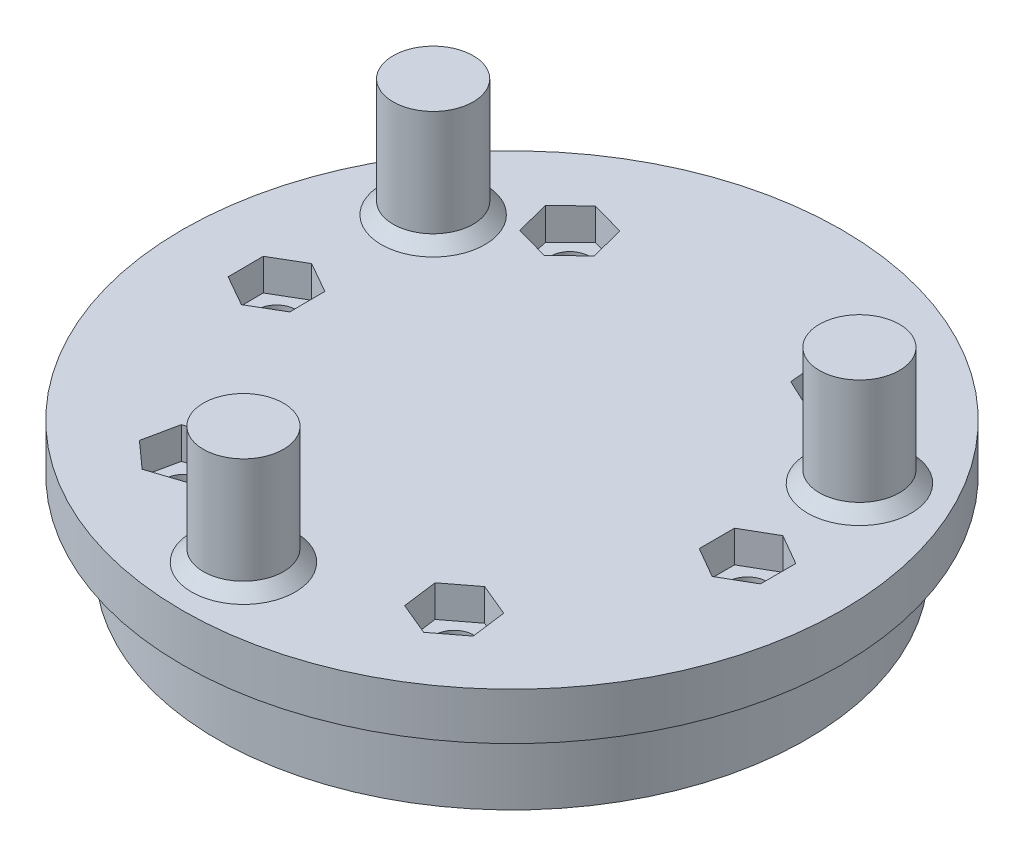
from build123d import *

# Parameters (mm, degrees)
SKETCH3_R               = 28
BOSS_EXTRUDE1_DEPTH     = 4
SKETCH6_R               = 25
BOSS_EXTRUDE4_DEPTH     = 7
SKETCH7_R               = 3.4
BOSS_EXTRUDE5_DEPTH     = 10
CUT_EXTRUDE1_DEPTH      = 10
CUT_EXTRUDE1_DEPTH_BACK = 43
SKETCH8_R               = 1.65
CUT_EXTRUDE3_DEPTH      = 2.7
CHAMFER1_SIZE           = 1


with BuildPart() as part:
    # Sketch3 → Boss-Extrude1 (new body)
    with BuildSketch(Plane(origin=(0, 0, 0), x_dir=(1, 0, 0), z_dir=(0, 1, 0))):
        Circle(SKETCH3_R)
    extrude(amount=BOSS_EXTRUDE1_DEPTH)

    # Sketch6 → Boss-Extrude4 (add)
    with BuildSketch(Plane.XZ):
        Circle(SKETCH6_R)
    extrude(amount=BOSS_EXTRUDE4_DEPTH)

    # Sketch7 → Boss-Extrude5 (add)
    with BuildSketch(Plane(origin=(0, 4, 0), x_dir=(1, 0, 0), z_dir=(0, 1, 0))):
        with Locations((-0.954174099, -21.854179847)):
            Circle(SKETCH7_R)
        with Locations((-18.449187877, 11.753428933)):
            Circle(SKETCH7_R)
        with Locations((19.403361976, 10.100750915)):
            Circle(SKETCH7_R)
    extrude(amount=BOSS_EXTRUDE5_DEPTH)

    # Sketch8 → Cut-Extrude1 (cut, two sides: drawn at the far end of the back side and taken through both)
    with BuildSketch(Plane.XZ.offset(-CUT_EXTRUDE1_DEPTH_BACK)):
        with Locations((20, 0)):
            Circle(SKETCH8_R)
        with Locations((-20, 0)):
            Circle(SKETCH8_R)
        with Locations((11.471528727, 16.383040886)):
            Circle(SKETCH8_R)
        with Locations((-11.471528727, -16.383040886)):
            Circle(SKETCH8_R)
        with Locations((11.471528727, -16.383040886)):
            Circle(SKETCH8_R)
        with Locations((-11.471528727, 16.383040886)):
            Circle(SKETCH8_R)
    extrude(amount=CUT_EXTRUDE1_DEPTH + CUT_EXTRUDE1_DEPTH_BACK, mode=Mode.SUBTRACT)

    # Sketch11 → Cut-Extrude3 (cut)
    with BuildSketch(Plane(origin=(0, 4, 0), x_dir=(1, 0, 0), z_dir=(0, 1, 0))):
        Polygon((11.858091258, -19.360271603), (14.243167426, -17.536883273), (13.856604896, -14.559652555), (11.084966196, -13.405810169), (8.699890028, -15.229198499), (9.086452558, -18.206429216), align=None)
        Polygon((-12.091418901, -19.320568674), (-9.237500125, -18.388645418), (-8.617609951, -15.45111763), (-10.851638553, -13.445513098), (-13.705557329, -14.377436353), (-14.325447503, -17.314964141), align=None)
        Polygon((-22.590586111, -1.517299224), (-19.981273382, -3.002162995), (-17.390687271, -1.48486377), (-17.409413889, 1.517299224), (-20.018726618, 3.002162995), (-22.609312729, 1.48486377), align=None)
        Polygon((20, -3.0022214), (22.6, -1.5011107), (22.6, 1.5011107), (20, 3.0022214), (17.4, 1.5011107), (17.4, -1.5011107), align=None)
        Polygon((9.008253879, 14.666762832), (11.726231698, 13.391643264), (14.189506546, 15.107921318), (13.934803575, 18.09931894), (11.216825756, 19.374438507), (8.753550908, 17.658160453), align=None)
        Polygon((-10.729703857, 13.473912288), (-8.581237024, 15.57091577), (-9.323061894, 18.480044367), (-12.213353597, 19.292169483), (-14.36182043, 17.195166002), (-13.61999556, 14.286037405), align=None)
    extrude(amount=-CUT_EXTRUDE3_DEPTH, mode=Mode.SUBTRACT)

    # Chamfer1
    chamfer1_edges = [part.edges().sort_by_distance(p)[0] for p in [
        (16.003361976, 4, -10.100750915),
        (-21.849187877, 4, -11.753428933),
        (-4.354174099, 4, 21.854179847),
    ]]
    chamfer(chamfer1_edges, length=CHAMFER1_SIZE)


solid = part.part
